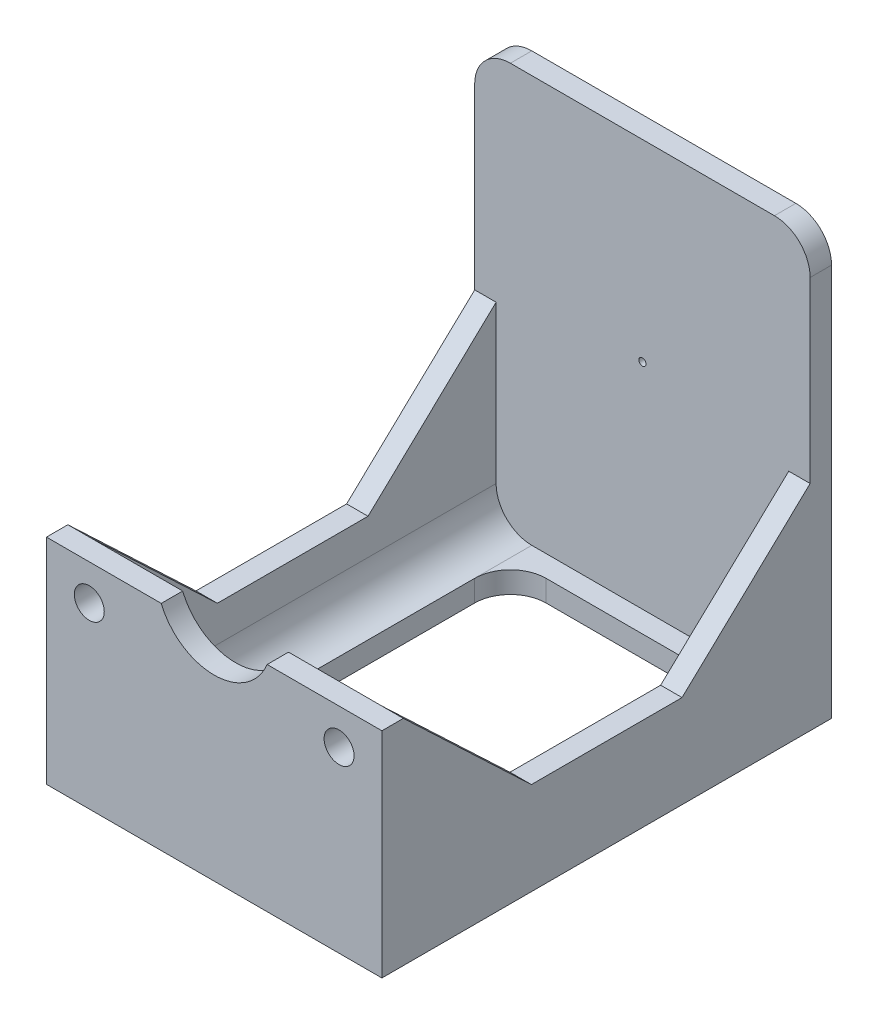
from build123d import *

# Parameters (mm, degrees)
SKETCH1_R           = 2.1
BOSS_EXTRUDE1_DEPTH = 3
EXTRUDE_THIN1_DEPTH = 47
BOSS_EXTRUDE2_DEPTH = 3
SKETCH4_W           = 31
SKETCH4_H           = 51
CUT_EXTRUDE1_DEPTH  = 72.0791812
FILLET3_R           = 5
BOSS_EXTRUDE3_DEPTH = 30
FILLET1_R           = 5
CUT_EXTRUDE3_REACH  = 75.33
SKETCH10_R          = 0.5
SKETCH11_R          = 4.15
CUT_EXTRUDE4_DEPTH  = 1
FILLET2_R           = 5


with BuildPart() as part:
    # Sketch1 → Boss-Extrude1 (new body)
    with BuildSketch(Plane.XY):
        with BuildLine():
            Line((7.416198487, 5), (23.5, 5))
            Line((23.5, 5), (23.5, -25))
            Line((23.5, -25), (-23.5, -25))
            Line((-23.5, -25), (-23.5, 5))
            Line((-23.5, 5), (-7.416198487, 5))
            ThreePointArc((-7.416198487, 5), (0, 0), (7.416198487, 5))
        make_face()
        with Locations((-17.5, 0)):
            Circle(SKETCH1_R, mode=Mode.SUBTRACT)
        with Locations(Location((17.5, 0, 0), (0, 0, 180))):
            Circle(SKETCH1_R, mode=Mode.SUBTRACT)
    extrude(amount=BOSS_EXTRUDE1_DEPTH)

    # Sketch2 → Extrude-Thin1 (add)
    with BuildSketch(Plane.ZY.offset(23.5)):
        Polygon((0, -25), (-60, -25), (-60, 5), (-57, 5), (-57, -22), (0, -22), align=None)
    extrude(amount=-EXTRUDE_THIN1_DEPTH)

    # Sketch3 → Boss-Extrude2 (add)
    with BuildSketch(Plane.ZY.offset(23.5)):
        Polygon((-57, 5), (-57, -22), (0, -22), (0, 5), (-17.944444444, -12), (-39.055555556, -12), align=None)
    boss_extrude2 = extrude(amount=-BOSS_EXTRUDE2_DEPTH)

    # Mirror1: Boss-Extrude2 across plane
    add(boss_extrude2.mirror(Plane(origin=(0, 0, 0), x_dir=(0, 0, 1), z_dir=(1, 0, 0))))

    # Sketch4 → Cut-Extrude1 (cut, through all)
    with BuildSketch(Plane.XZ.offset(25)):
        with Locations((0, -28.5)):
            Rectangle(SKETCH4_W, SKETCH4_H)
    extrude(amount=-CUT_EXTRUDE1_DEPTH, mode=Mode.SUBTRACT)

    # Fillet3
    fillet3_edges = [part.edges().sort_by_distance(p)[0] for p in [
        (15.5, -23.5, -3),
        (15.5, -23.5, -54),
        (-15.5, -23.5, -54),
        (-15.5, -23.5, -3),
    ]]
    fillet(fillet3_edges, radius=FILLET3_R)

    # Sketch6 → Boss-Extrude3 (add)
    with BuildSketch(Plane(origin=(0, 5, 0), x_dir=(1, 0, 0), z_dir=(0, 1, 0))):
        Polygon((20.5, 57), (23.5, 57), (23.5, 60), (-23.5, 60), (-23.5, 57), (-20.5, 57), align=None)
    extrude(amount=BOSS_EXTRUDE3_DEPTH)

    # Fillet1
    fillet1_edges = [part.edges().sort_by_distance(p)[0] for p in [
        (-20.5, -22, -28.5),
        (20.5, -22, -28.5),
    ]]
    fillet(fillet1_edges, radius=FILLET1_R - 0.0001)  # a hair under: the kernel refuses the full size

    # Sketch10 → Cut-Extrude3 (cut, up to next)
    with BuildSketch(Plane.XY.offset(-57), mode=Mode.PRIVATE) as cut_extrude3_sk1:
        with Locations((0, 8)):
            Circle(SKETCH10_R)
    cut_extrude3_tool1 = extrude(cut_extrude3_sk1.sketch, amount=-CUT_EXTRUDE3_REACH, mode=Mode.PRIVATE) & part.part
    add(cut_extrude3_tool1.solids().sort_by_distance((0, 8, -57))[0], mode=Mode.SUBTRACT)

    # Sketch11 → Cut-Extrude4 (cut)
    with BuildSketch(Plane(origin=(0, 0, -60), x_dir=(-1, 0, 0), z_dir=(0, 0, -1))):
        with Locations((-18.5, 30)):
            Circle(SKETCH11_R)
        with Locations((18.5, 30)):
            Circle(SKETCH11_R)
        with Locations((-18.5, -20)):
            Circle(SKETCH11_R)
        with Locations((18.5, -20)):
            Circle(SKETCH11_R)
    extrude(amount=-CUT_EXTRUDE4_DEPTH, mode=Mode.SUBTRACT)

    # Fillet2
    fillet2_edges = [part.edges().sort_by_distance(p)[0] for p in [
        (23.5, 35, -58.5),
        (-23.5, 35, -58.5),
    ]]
    fillet(fillet2_edges, radius=FILLET2_R)


solid = part.part
